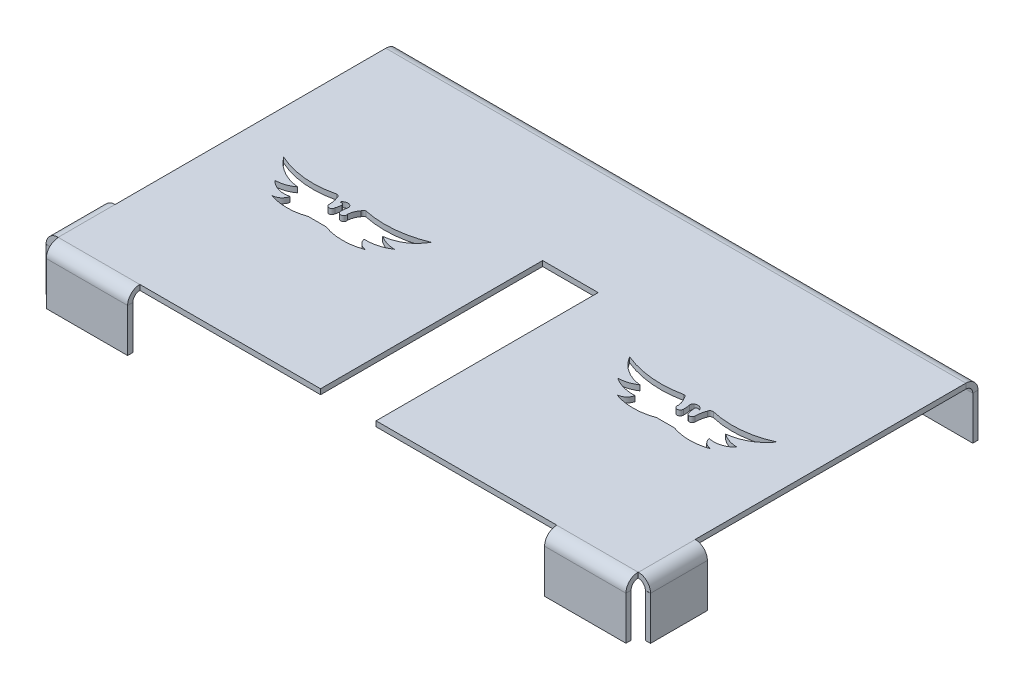
from build123d import *

# Parameters (mm, degrees)
SKETCH1_W                    = 271.78
SKETCH1_H                    = 156.21
BASE_FLANGE1_DEPTH           = 2.38125
EDGE_FLANGE1_STRIP_W         = 15.875
EDGE_FLANGE1_STRIP_H         = 2.38125
EDGE_FLANGE1_STRIP_CUT_DEPTH = 271.78
EDGE_FLANGE1_DEPTH           = 271.78
EDGE_FLANGE2_STRIP_W         = 15.875
EDGE_FLANGE2_STRIP_H         = 2.38125
EDGE_FLANGE2_STRIP_CUT_DEPTH = 153.035
EDGE_FLANGE2_DEPTH           = 153.035
SKETCH14_W                   = 127
SKETCH14_H                   = 30.097595223
CUT_EXTRUDE1_DEPTH           = 5.588
EDGE_FLANGE3_STRIP_W         = 15.875
EDGE_FLANGE3_STRIP_H         = 2.38125
EDGE_FLANGE3_STRIP_CUT_DEPTH = 153.035
EDGE_FLANGE3_DEPTH           = 153.035
SKETCH18_W                   = 127
SKETCH18_H                   = 45.504454023
CUT_EXTRUDE2_DEPTH           = 5.588
CUT_EXTRUDE3_START           = -3.302
CUT_EXTRUDE3_DEPTH           = 5.68325
CUT_EXTRUDE4_START           = -3.302
CUT_EXTRUDE4_DEPTH           = 5.68325
EDGE_FLANGE4_STRIP_W         = 15.875
EDGE_FLANGE4_STRIP_H         = 2.38125
EDGE_FLANGE4_STRIP_CUT_DEPTH = 265.3665
EDGE_FLANGE4_DEPTH           = 265.3665
SKETCH24_W                   = 190.754
SKETCH24_H                   = 70.532416994
CUT_EXTRUDE5_DEPTH           = 5.588
SKETCH25_W                   = 25.4
SKETCH25_H                   = 203.2
CUT_EXTRUDE6_DEPTH           = 2.54
CUT_EXTRUDE7_DEPTH           = 162.994243773


# Read off the part's stored shape, not the designer's step: Cut-Extrude3, Cut-Extrude4
# Sheet-metal steps are written as plain solids
with BuildPart() as part:
    # Sketch1 → Base-Flange1 (new body)
    with BuildSketch(Plane(origin=(0, 0, 0), x_dir=(1, 0, 0), z_dir=(0, 1, 0))):
        Rectangle(SKETCH1_W, SKETCH1_H)
    extrude(amount=-BASE_FLANGE1_DEPTH)

    # Edge-Flange1 strip (across the edge) → Edge-Flange1 strip cut (cut)
    with BuildSketch(Plane(origin=(135.89, -2.38125, 78.105), x_dir=(0, 0, -1), z_dir=(-1, 0, 0))):
        with Locations((-4.7625, -1.190625)):
            Rectangle(EDGE_FLANGE1_STRIP_W, EDGE_FLANGE1_STRIP_H)
    extrude(amount=EDGE_FLANGE1_STRIP_CUT_DEPTH, mode=Mode.SUBTRACT)

    # Edge-Flange1 section (across the edge) → Edge-Flange1 (add)
    with BuildSketch(Plane(origin=(135.89, -2.38125, 78.105), x_dir=(0, 0, -1), z_dir=(-1, 0, 0))):
        with BuildLine():
            Line((-2.38125, 3.175), (-2.38125, 23.01875))
            Line((-2.38125, 23.01875), (0, 23.01875))
            Line((0, 23.01875), (0, 3.175))
            ThreePointArc((0, 3.175), (0.92993597, 0.92993597), (3.175, 0))
            Line((3.175, 0), (3.175, -2.38125))
            ThreePointArc((3.175, -2.38125), (-0.753862053, -0.753862053), (-2.38125, 3.175))
        make_face()
    extrude(amount=EDGE_FLANGE1_DEPTH)

    # Edge-Flange2 strip (across the edge) → Edge-Flange2 strip cut (cut)
    with BuildSketch(Plane(origin=(135.89, -2.38125, -78.105), x_dir=(-1, 0, 0), z_dir=(0, 0, 1))):
        with Locations((-4.7625, -1.190625)):
            Rectangle(EDGE_FLANGE2_STRIP_W, EDGE_FLANGE2_STRIP_H)
    extrude(amount=EDGE_FLANGE2_STRIP_CUT_DEPTH, mode=Mode.SUBTRACT)

    # Edge-Flange2 section (across the edge) → Edge-Flange2 (add)
    with BuildSketch(Plane(origin=(135.89, -2.38125, -78.105), x_dir=(-1, 0, 0), z_dir=(0, 0, 1))):
        with BuildLine():
            Line((-2.38125, 3.175), (-2.38125, 23.01875))
            Line((-2.38125, 23.01875), (0, 23.01875))
            Line((0, 23.01875), (0, 3.175))
            ThreePointArc((0, 3.175), (0.92993597, 0.92993597), (3.175, 0))
            Line((3.175, 0), (3.175, -2.38125))
            ThreePointArc((3.175, -2.38125), (-0.753862053, -0.753862053), (-2.38125, 3.175))
        make_face()
    extrude(amount=EDGE_FLANGE2_DEPTH)

    # Sketch14 → Cut-Extrude1 (cut)
    with BuildSketch(Plane(origin=(138.27125, 0, 0), x_dir=(0, 0, -1), z_dir=(1, 0, 0))):
        with Locations((14.605, -10.351202389)):
            Rectangle(SKETCH14_W, SKETCH14_H)
    extrude(amount=-CUT_EXTRUDE1_DEPTH, mode=Mode.SUBTRACT)

    # Edge-Flange3 strip (across the edge) → Edge-Flange3 strip cut (cut)
    with BuildSketch(Plane(origin=(-135.89, -2.38125, 74.93), x_dir=(1, 0, 0), z_dir=(0, 0, -1))):
        with Locations((-4.7625, -1.190625)):
            Rectangle(EDGE_FLANGE3_STRIP_W, EDGE_FLANGE3_STRIP_H)
    extrude(amount=EDGE_FLANGE3_STRIP_CUT_DEPTH, mode=Mode.SUBTRACT)

    # Edge-Flange3 section (across the edge) → Edge-Flange3 (add)
    with BuildSketch(Plane(origin=(-135.89, -2.38125, 74.93), x_dir=(1, 0, 0), z_dir=(0, 0, -1))):
        with BuildLine():
            Line((-2.38125, 3.175), (-2.38125, 23.01875))
            Line((-2.38125, 23.01875), (0, 23.01875))
            Line((0, 23.01875), (0, 3.175))
            ThreePointArc((0, 3.175), (0.92993597, 0.92993597), (3.175, 0))
            Line((3.175, 0), (3.175, -2.38125))
            ThreePointArc((3.175, -2.38125), (-0.753862053, -0.753862053), (-2.38125, 3.175))
        make_face()
    extrude(amount=EDGE_FLANGE3_DEPTH)

    # Sketch18 → Cut-Extrude2 (cut)
    with BuildSketch(Plane.ZY.offset(138.27125)):
        with Locations((-14.605, -2.647772988)):
            Rectangle(SKETCH18_W, SKETCH18_H)
    extrude(amount=-CUT_EXTRUDE2_DEPTH, mode=Mode.SUBTRACT)

    # Cut-Extrude3 outline → Cut-Extrude3 (cut)
    with BuildSketch(Plane.ZY.offset(135.89).offset(CUT_EXTRUDE3_START)):
        with BuildLine():
            Line((74.93, 0), (74.89825, 0))
            Line((74.89825, 0), (74.89825, -5.55625))
            Line((74.89825, -5.55625), (74.93, -5.55625))
            Line((74.93, -5.55625), (74.93, -2.38125))
            ThreePointArc((74.93, -2.38125), (77.17506403, -3.31118597), (78.105, -5.55625))
            Line((78.105, -5.55625), (78.105, -25.4))
            Line((78.105, -25.4), (80.48625, -25.4))
            Line((80.48625, -25.4), (80.48625, -5.55625))
            ThreePointArc((80.48625, -5.55625), (78.858862053, -1.627387947), (74.93, 0))
        make_face()
    extrude(amount=CUT_EXTRUDE3_DEPTH, mode=Mode.SUBTRACT)

    # Cut-Extrude4 outline → Cut-Extrude4 (cut)
    with BuildSketch(Plane(origin=(135.89, 0, 0), x_dir=(0, 0, -1), z_dir=(1, 0, 0)).offset(CUT_EXTRUDE4_START)):
        with BuildLine():
            Line((-74.89825, 0), (-74.93, 0))
            ThreePointArc((-74.93, 0), (-78.858862053, -1.627387947), (-80.48625, -5.55625))
            Line((-80.48625, -5.55625), (-80.48625, -25.4))
            Line((-80.48625, -25.4), (-78.105, -25.4))
            Line((-78.105, -25.4), (-78.105, -5.55625))
            ThreePointArc((-78.105, -5.55625), (-77.17506403, -3.31118597), (-74.93, -2.38125))
            Line((-74.93, -2.38125), (-74.93, -5.55625))
            Line((-74.93, -5.55625), (-74.89825, -5.55625))
            Line((-74.89825, -5.55625), (-74.89825, 0))
        make_face()
    extrude(amount=CUT_EXTRUDE4_DEPTH, mode=Mode.SUBTRACT)

    # Edge-Flange4 strip (across the edge) → Edge-Flange4 strip cut (cut)
    with BuildSketch(Plane(origin=(-132.68325, -2.38125, -78.105), x_dir=(0, 0, 1), z_dir=(1, 0, 0))):
        with Locations((-4.7625, -1.190625)):
            Rectangle(EDGE_FLANGE4_STRIP_W, EDGE_FLANGE4_STRIP_H)
    extrude(amount=EDGE_FLANGE4_STRIP_CUT_DEPTH, mode=Mode.SUBTRACT)

    # Edge-Flange4 section (across the edge) → Edge-Flange4 (add)
    with BuildSketch(Plane(origin=(-132.68325, -2.38125, -78.105), x_dir=(0, 0, 1), z_dir=(1, 0, 0))):
        with BuildLine():
            Line((-2.38125, 3.175), (-2.38125, 23.01875))
            Line((-2.38125, 23.01875), (0, 23.01875))
            Line((0, 23.01875), (0, 3.175))
            ThreePointArc((0, 3.175), (0.92993597, 0.92993597), (3.175, 0))
            Line((3.175, 0), (3.175, -2.38125))
            ThreePointArc((3.175, -2.38125), (-0.753862053, -0.753862053), (-2.38125, 3.175))
        make_face()
    extrude(amount=EDGE_FLANGE4_DEPTH)

    # Sketch24 → Cut-Extrude5 (cut)
    with BuildSketch(Plane.XY.offset(80.48625)):
        Rectangle(SKETCH24_W, SKETCH24_H)
    extrude(amount=-CUT_EXTRUDE5_DEPTH, mode=Mode.SUBTRACT)

    # Sketch25 → Cut-Extrude6 (cut)
    with BuildSketch(Plane(origin=(0, 0, 0), x_dir=(1, 0, 0), z_dir=(0, 1, 0))):
        with Locations((0, -74.89825)):
            Rectangle(SKETCH25_W, SKETCH25_H)
    extrude(amount=-CUT_EXTRUDE6_DEPTH, mode=Mode.SUBTRACT)

    # Sketch27 → Cut-Extrude7 (cut, through all)
    with BuildSketch(Plane(origin=(0, 0, 0), x_dir=(1, 0, 0), z_dir=(0, 1, 0))):
        with BuildLine():
            Line((-83.758838792, -9.45585461), (-75.67290259, -9.45585461))
            ThreePointArc((-75.67290259, -9.45585461), (-66.490988533, -11.087337706), (-57.309074476, -9.45585461))
            ThreePointArc((-57.309074476, -9.45585461), (-60.311983549, -8.390373583), (-61.996874262, -5.685959414))
            ThreePointArc((-61.996874262, -5.685959414), (-56.305231118, -5.091134548), (-51.075646545, -2.767330875))
            ThreePointArc((-51.075646545, -2.767330875), (-55.130053613, -2.067384812), (-58.848260419, -0.305828877))
            ThreePointArc((-58.848260419, -0.305828877), (-51.075646545, 2.428004784), (-45.41334394, 8.413462337))
            ThreePointArc((-45.41334394, 8.413462337), (-58.848260419, 5.108292363), (-72.661500429, 5.892849412))
            ThreePointArc((-72.661500429, 5.892849412), (-73.515570568, 5.659234682), (-73.954298796, 4.890125335))
            ThreePointArc((-73.954298796, 4.890125335), (-75.13069526, 2.764954432), (-75.67290259, 0.397197853))
            ThreePointArc((-75.67290259, 0.397197853), (-76.825891015, -1.427766493), (-78.414472909, 0.033836989))
            ThreePointArc((-78.414472909, 0.033836989), (-78.361782981, 1.568210714), (-78.121423666, 3.084557099))
            ThreePointArc((-78.121423666, 3.084557099), (-78.226332012, 3.859871666), (-78.703089746, 4.480210688))
            ThreePointArc((-78.703089746, 4.480210688), (-80.87974367, 4.787634603), (-82.4208484, 3.22004793))
            ThreePointArc((-82.4208484, 3.22004793), (-81.410815763, 3.612426431), (-80.592319592, 2.902362466))
            ThreePointArc((-80.592319592, 2.902362466), (-80.7316121, 1.449976952), (-81.082858007, 0.033836989))
            ThreePointArc((-81.082858007, 0.033836989), (-82.403929905, -1.321071898), (-83.758838792, 0))
            ThreePointArc((-83.758838792, 0), (-83.995302952, 2.406365651), (-84.636907307, 4.737643154))
            ThreePointArc((-84.636907307, 4.737643154), (-85.225763559, 5.644402971), (-86.283323823, 5.869194738))
            ThreePointArc((-86.283323823, 5.869194738), (-99.782272929, 4.924826167), (-112.856785411, 8.413462337))
            ThreePointArc((-112.856785411, 8.413462337), (-106.309643061, 2.541856444), (-97.946894022, -0.179403782))
            ThreePointArc((-97.946894022, -0.179403782), (-101.622165605, -2.103854793), (-105.71739849, -2.767330875))
            ThreePointArc((-105.71739849, -2.767330875), (-101.192410266, -5.584137657), (-95.863287335, -5.685959414))
            ThreePointArc((-95.863287335, -5.685959414), (-97.475971718, -8.374084711), (-100.418171986, -9.45585461))
            ThreePointArc((-100.418171986, -9.45585461), (-92.088505389, -10.899131081), (-83.758838792, -9.45585461))
        make_face()
        with BuildLine():
            Line((83.758838792, -9.45585461), (75.67290259, -9.45585461))
            ThreePointArc((75.67290259, -9.45585461), (66.490988533, -11.087337706), (57.309074476, -9.45585461))
            ThreePointArc((57.309074476, -9.45585461), (60.311983549, -8.390373583), (61.996874262, -5.685959414))
            ThreePointArc((61.996874262, -5.685959414), (56.305231118, -5.091134548), (51.075646545, -2.767330875))
            ThreePointArc((51.075646545, -2.767330875), (55.130053613, -2.067384812), (58.848260419, -0.305828877))
            ThreePointArc((58.848260419, -0.305828877), (51.075646545, 2.428004784), (45.41334394, 8.413462337))
            ThreePointArc((45.41334394, 8.413462337), (58.848260419, 5.108292363), (72.661500429, 5.892849412))
            ThreePointArc((72.661500429, 5.892849412), (73.515570568, 5.659234682), (73.954298796, 4.890125335))
            ThreePointArc((73.954298796, 4.890125335), (75.13069526, 2.764954432), (75.67290259, 0.397197853))
            ThreePointArc((75.67290259, 0.397197853), (76.825891015, -1.427766493), (78.414472909, 0.033836989))
            ThreePointArc((78.414472909, 0.033836989), (78.361782981, 1.568210714), (78.121423666, 3.084557099))
            ThreePointArc((78.121423666, 3.084557099), (78.226332012, 3.859871666), (78.703089746, 4.480210688))
            ThreePointArc((78.703089746, 4.480210688), (80.87974367, 4.787634603), (82.4208484, 3.22004793))
            ThreePointArc((82.4208484, 3.22004793), (81.410815763, 3.612426431), (80.592319592, 2.902362466))
            ThreePointArc((80.592319592, 2.902362466), (80.7316121, 1.449976952), (81.082858007, 0.033836989))
            ThreePointArc((81.082858007, 0.033836989), (82.403929905, -1.321071898), (83.758838792, 0))
            ThreePointArc((83.758838792, 0), (83.995302952, 2.406365651), (84.636907307, 4.737643154))
            ThreePointArc((84.636907307, 4.737643154), (85.225763559, 5.644402971), (86.283323823, 5.869194738))
            ThreePointArc((86.283323823, 5.869194738), (99.782272929, 4.924826167), (112.856785411, 8.413462337))
            ThreePointArc((112.856785411, 8.413462337), (106.309643061, 2.541856444), (97.946894022, -0.179403782))
            ThreePointArc((97.946894022, -0.179403782), (101.622165605, -2.103854793), (105.71739849, -2.767330875))
            ThreePointArc((105.71739849, -2.767330875), (101.192410266, -5.584137657), (95.863287335, -5.685959414))
            ThreePointArc((95.863287335, -5.685959414), (97.475971718, -8.374084711), (100.418171986, -9.45585461))
            ThreePointArc((100.418171986, -9.45585461), (92.088505389, -10.899131081), (83.758838792, -9.45585461))
        make_face()
    extrude(amount=-CUT_EXTRUDE7_DEPTH, mode=Mode.SUBTRACT)


solid = part.part
